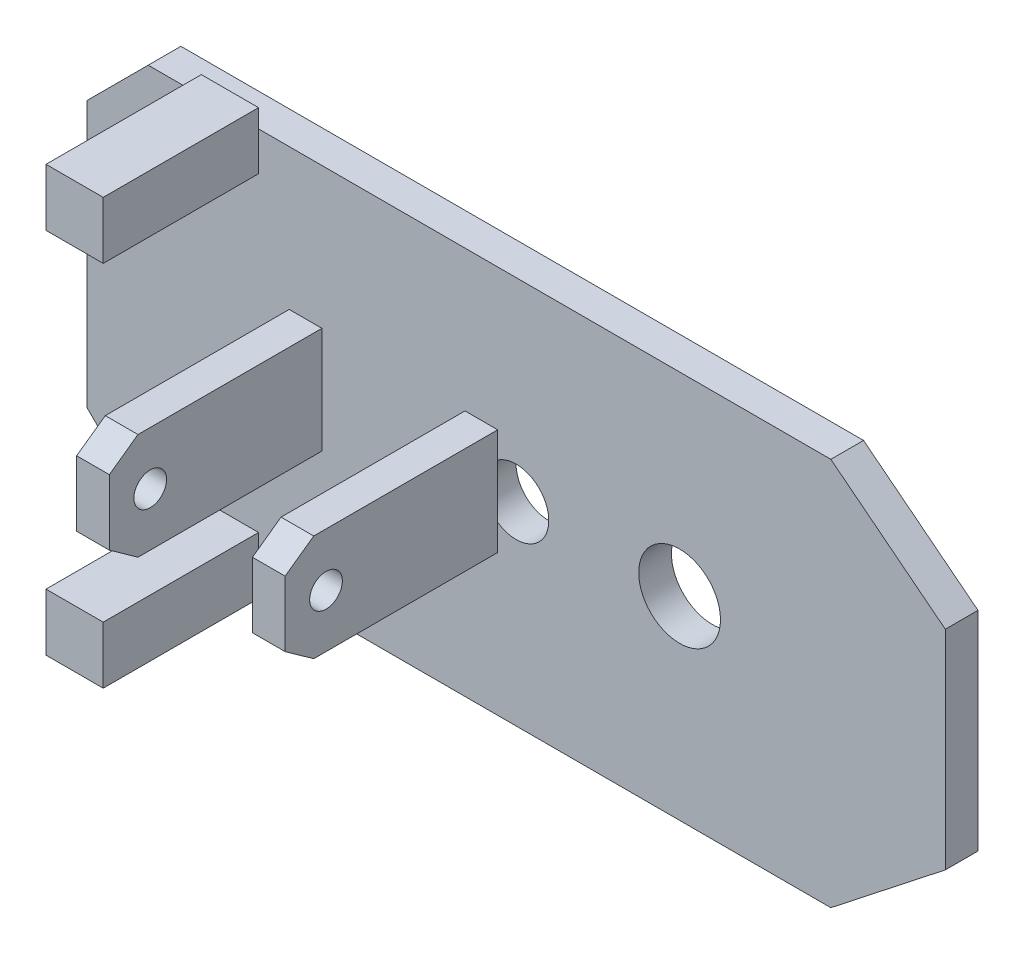
from build123d import *

# Parameters (mm, degrees)
SK_SOLE_PLATE_R    = 10
SK_SOLE_PLATE_R_2  = 8
SOLE_PLATE_DEPTH   = 8
SK_CLEVIS_FRONT_R  = 4
CLEVIS_FRONT_DEPTH = 8
SK_CLEVIS_BACK_R   = 4
CLEVIS_BACK_DEPTH  = 8
SK_POST_LAT_W      = 14
SK_POST_LAT_H      = 14
POST_LAT_DEPTH     = 38
SK_POST_MED_W      = 14
SK_POST_MED_H      = 14
POST_MED_DEPTH     = 38


with BuildPart() as part:
    # SK_Sole_Plate → Sole_Plate (new body)
    with BuildSketch(Plane.XY.offset(-50)):
        Polygon((-60, -47.5), (107, -47.5), (135, -25.5), (135, 25.5), (107, 47.5), (-60, 47.5), (-75, 32.5), (-75, -32.5), align=None)
        with Locations((70, 0)):
            Circle(SK_SOLE_PLATE_R, mode=Mode.SUBTRACT)
        with Locations((30, 0)):
            Circle(SK_SOLE_PLATE_R_2, mode=Mode.SUBTRACT)
    extrude(amount=SOLE_PLATE_DEPTH)

    # SK_Clevis_Front → Clevis_Front (add)
    with BuildSketch(Plane(origin=(17.5, 0, 0), x_dir=(0, 0, -1), z_dir=(1, 0, 0))):
        Polygon((42, -13), (42, 13), (-3, 13), (-10, 8), (-10, -8), (-3, -13), align=None)
        Circle(SK_CLEVIS_FRONT_R, mode=Mode.SUBTRACT)
    extrude(amount=CLEVIS_FRONT_DEPTH)

    # SK_Clevis_Back → Clevis_Back (add)
    with BuildSketch(Plane(origin=(-25.5, 0, 0), x_dir=(0, 0, -1), z_dir=(1, 0, 0))):
        Polygon((42, -13), (42, 13), (-3, 13), (-10, 8), (-10, -8), (-3, -13), align=None)
        Circle(SK_CLEVIS_BACK_R, mode=Mode.SUBTRACT)
    extrude(amount=CLEVIS_BACK_DEPTH)

    # SK_Post_Lat → Post_Lat (add)
    with BuildSketch(Plane.XY.offset(-42)):
        with Locations((-40, 45)):
            Rectangle(SK_POST_LAT_W, SK_POST_LAT_H)
    extrude(amount=POST_LAT_DEPTH)

    # SK_Post_Med → Post_Med (add)
    with BuildSketch(Plane.XY.offset(-42)):
        with Locations((-40, -45)):
            Rectangle(SK_POST_MED_W, SK_POST_MED_H)
    extrude(amount=POST_MED_DEPTH)


solid = part.part
